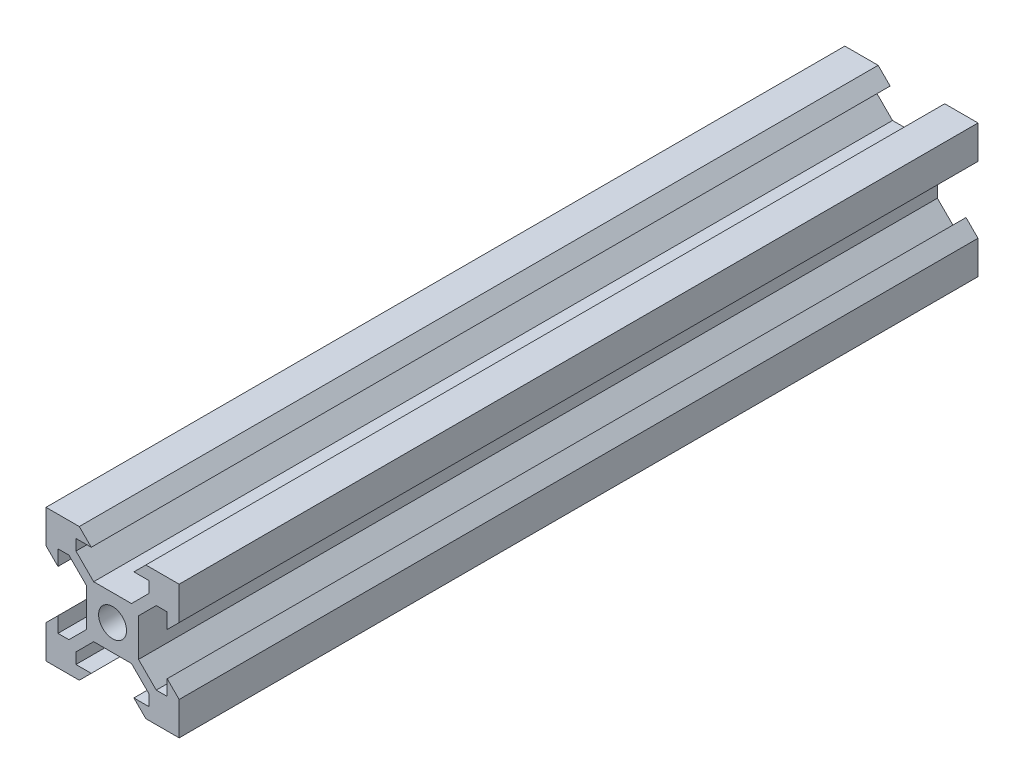
from build123d import *

# Parameters (mm, degrees)
SKETCH1_R           = 2.1
BOSS_EXTRUDE1_DEPTH = 60


with BuildPart() as part:
    # Sketch1 → Boss-Extrude1 (new, symmetric)
    with BuildSketch(Plane.XY):
        Polygon((-10, 10), (-5, 10), (-3.2, 8.2), (-5.499339828, 8.2), (-5.499339828, 6.56), (-2.84, 3.900660172), (2.84, 3.900660172), (5.499339828, 6.56), (5.499339828, 8.2), (3.2, 8.2), (5, 10), (10, 10), (10, 5), (8.2, 3.2), (8.2, 5.499339828), (6.56, 5.499339828), (3.900660172, 2.84), (3.900660172, -2.84), (6.56, -5.499339828), (8.2, -5.499339828), (8.2, -3.2), (10, -5), (10, -10), (5, -10), (3.2, -8.2), (5.499339828, -8.2), (5.499339828, -6.56), (2.84, -3.900660172), (-2.84, -3.900660172), (-5.499339828, -6.56), (-5.499339828, -8.2), (-3.2, -8.2), (-5, -10), (-10, -10), (-10, -5), (-8.2, -3.2), (-8.2, -5.499339828), (-6.56, -5.499339828), (-3.900660172, -2.84), (-3.900660172, 2.84), (-6.56, 5.499339828), (-8.2, 5.499339828), (-8.2, 3.2), (-10, 5), align=None)
        Circle(SKETCH1_R, mode=Mode.SUBTRACT)
    extrude(amount=BOSS_EXTRUDE1_DEPTH, both=True)


solid = part.part
